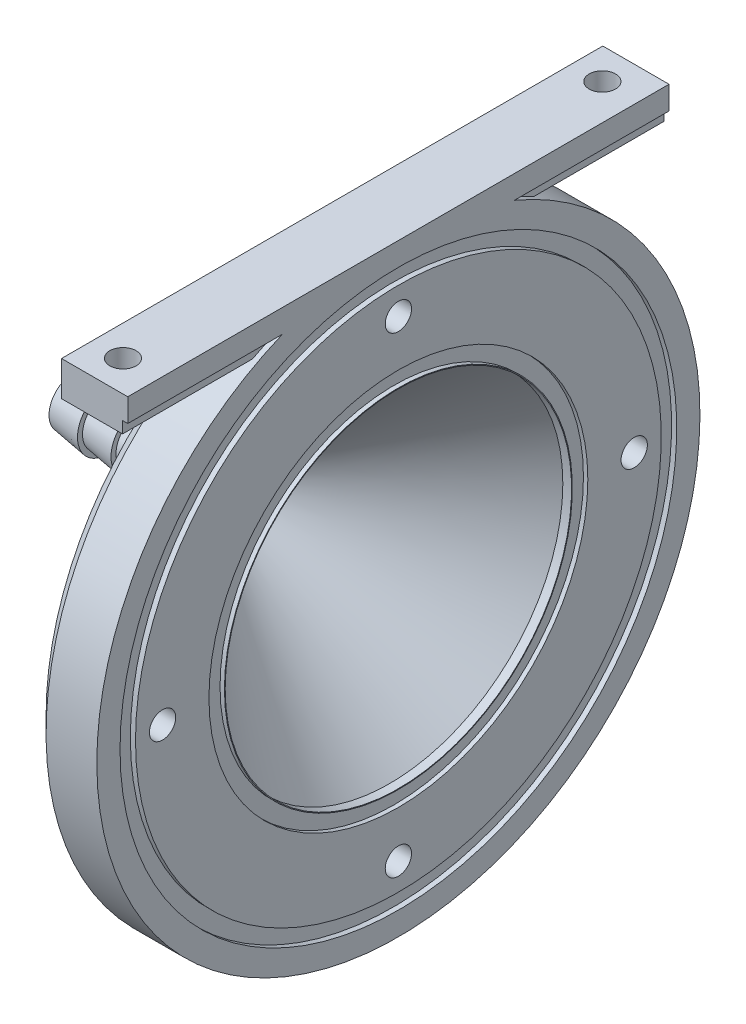
from build123d import *

# Parameters (mm, degrees)
M3_CLEARANCE_HOLE1_D     = 3.4
M3_CLEARANCE_HOLE1_DEPTH = 8.566
M3_CLEARANCE_HOLE1_TIP   = 1.021463052
CHAMFER1_SIZE            = 2
BOSS_EXTRUDE1_DEPTH      = 35
SKETCH9_R                = 1.7
CUT_EXTRUDE1_DEPTH       = 10


with BuildPart() as part:
    # Sketch1 → Revolve17 (revolve)
    with BuildSketch(Plane.XY):
        Polygon((-14.010170791, 3.15), (-14.010170791, 3.8), (-18.343504124, 3.15), (-18.343504124, 1.9), (0, 1.9), (22.555350238, 22.4), (23.687350238, 22.4), (23.687350238, 22.5), (23.121350238, 22.5), (23.121350238, 24.5), (23.687350238, 24.5), (23.687350238, 34), (23.020350238, 34), (23.020350238, 36), (23.687350238, 36), (23.687350238, 39), (15.121350238, 39), (15.121350238, 22.4), (-5.343504124, 3.8), (-9.676837458, 3.15), (-9.676837458, 3.8), align=None)
    revolve(axis=Axis((-801.927103621, 0, 0), (1, 0, 0)))

    # M3 Clearance Hole1
    with Locations(Plane.ZY.offset(-15.121350238)):
        with Locations((0, -30.5), (0, 30.5), (30.5, 0), (-30.5, 0)):
            Hole(M3_CLEARANCE_HOLE1_D / 2, depth=M3_CLEARANCE_HOLE1_DEPTH)
            with Locations((0, 0, -(M3_CLEARANCE_HOLE1_DEPTH + M3_CLEARANCE_HOLE1_TIP / 2))):  # 118° drill point
                Cone(0, M3_CLEARANCE_HOLE1_D / 2, M3_CLEARANCE_HOLE1_TIP, mode=Mode.SUBTRACT)

    # Chamfer1
    chamfer1_edges = [part.edges().sort_by_distance(p)[0] for p in [
        (15.121350238, -39, 0),
    ]]
    chamfer(chamfer1_edges, length=CHAMFER1_SIZE)

    # Sketch1<11> → Boss-Extrude1 (add, symmetric)
    with BuildSketch(Plane.XY):
        Polygon((15.121350238, 39), (15.121350238, 34.5), (23.020350238, 34.5), (23.020350238, 36), (23.687350238, 36), (23.687350238, 39), align=None)
    extrude(amount=BOSS_EXTRUDE1_DEPTH, both=True)

    # Sketch9 → Cut-Extrude1 (cut)
    with BuildSketch(Plane(origin=(0, 34.5, 0), x_dir=(-1, 0, 0), z_dir=(0, -1, 0))):
        with Locations((-19.070850238, -31)):
            Circle(SKETCH9_R)
        with Locations((-19.070850238, 31)):
            Circle(SKETCH9_R)
    extrude(amount=-CUT_EXTRUDE1_DEPTH, mode=Mode.SUBTRACT)


solid = part.part
